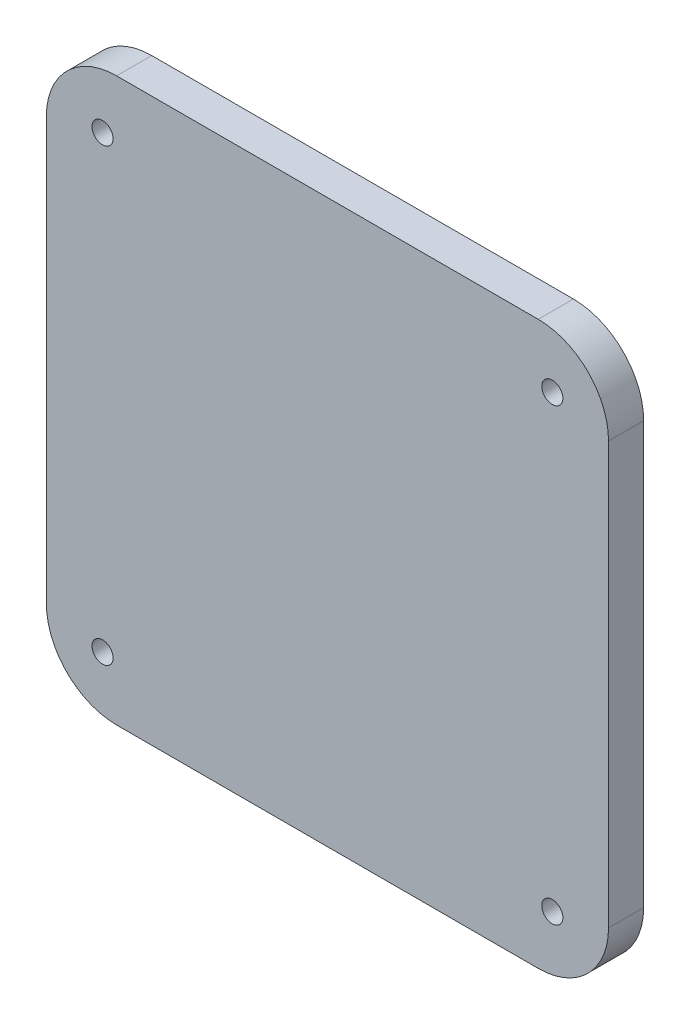
from build123d import *

# Parameters (mm, degrees)
ESQUISSE1_W                  = 80
ESQUISSE1_H                  = 80
BOSS_EXTRU_1_DEPTH           = 5
CONG_1_R                     = 10
ENL_V_MAT_EXTRU_4_DEPTH      = 57.789083458
ENL_V_MAT_EXTRU_4_DEPTH_BACK = 57.789083458
ESQUISSE5_R                  = 1.5


with BuildPart() as part:
    # Esquisse1 → Boss.-Extru.1 (new body)
    with BuildSketch(Plane.XY):
        Rectangle(ESQUISSE1_W, ESQUISSE1_H)
    extrude(amount=BOSS_EXTRU_1_DEPTH)

    # Congé1
    cong_1_edges = [part.edges().sort_by_distance(p)[0] for p in [
        (-40, -40, 2.5),
        (40, -40, 2.5),
        (40, 40, 2.5),
        (-40, 40, 2.5),
    ]]
    fillet(cong_1_edges, radius=CONG_1_R)

    # Esquisse5 → Enlèv. mat.-Extru.4 (cut, two sides: drawn at the far end of the back side and taken through both)
    with BuildSketch(Plane.XY.offset(5).offset(-ENL_V_MAT_EXTRU_4_DEPTH_BACK)):
        with Locations((32, 32)):
            Circle(ESQUISSE5_R)
        with Locations((-32, 32)):
            Circle(ESQUISSE5_R)
        with Locations((-32, -32)):
            Circle(ESQUISSE5_R)
        with Locations((32, -32)):
            Circle(ESQUISSE5_R)
    extrude(amount=ENL_V_MAT_EXTRU_4_DEPTH + ENL_V_MAT_EXTRU_4_DEPTH_BACK, mode=Mode.SUBTRACT)


solid = part.part
